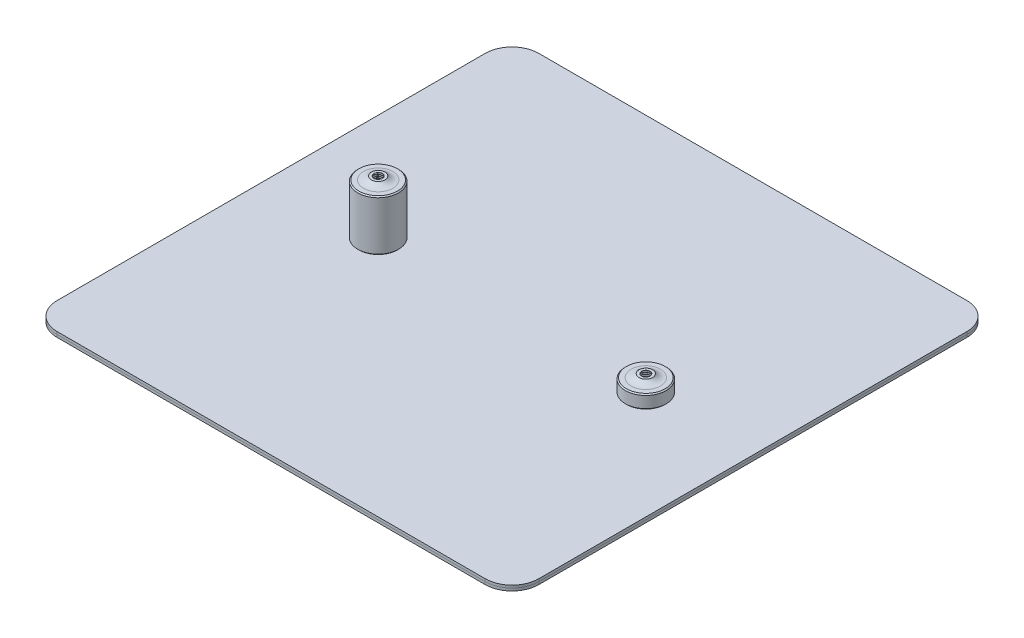
from build123d import *

# Parameters (mm, degrees)
CROQUIS1_R              = 4.9022
SALIENTE_EXTRUIR1_DEPTH = 2.4
CROQUIS2_R              = 19.05
CROQUIS2_R_2            = 3.96875
SALIENTE_EXTRUIR2_DEPTH = 47.625
CROQUIS3_R              = 6.35
CROQUIS3_R_2            = 3.96875
SALIENTE_EXTRUIR3_DEPTH = 3.175
REDONDEO1_R             = 10
ROSCA1_PITCH            = 1.5875
CROQUIS6_R              = 19.05
CROQUIS6_R_2            = 3.96875
SALIENTE_EXTRUIR4_DEPTH = 12.7
CROQUIS7_R              = 6.35
CROQUIS7_R_2            = 3.96875
SALIENTE_EXTRUIR5_DEPTH = 3.175
REDONDEO2_R             = 10
ROSCA2_PITCH            = 1.5875
CHAFL_N1_SIZE           = 1
CHAFL_N2_SIZE           = 1


with BuildPart() as part:
    # Croquis1 → Saliente-Extruir1 (new body)
    with BuildSketch(Plane(origin=(0, 0, 0), x_dir=(1, 0, 0), z_dir=(0, 1, 0))):
        with BuildLine():
            Line((-200, 225), (200, 225))
            ThreePointArc((200, 225), (217.67766953, 217.67766953), (225, 200))
            Line((225, 200), (225, -200))
            ThreePointArc((225, -200), (217.67766953, -217.67766953), (200, -225))
            Line((200, -225), (-200, -225))
            ThreePointArc((-200, -225), (-217.67766953, -217.67766953), (-225, -200))
            Line((-225, -200), (-225, 200))
            ThreePointArc((-225, 200), (-217.67766953, 217.67766953), (-200, 225))
        make_face()
        with Locations(Location((-125, 0, 0), (0, 0, 270))):
            Circle(CROQUIS1_R, mode=Mode.SUBTRACT)
        with Locations(Location((125, 0, 0), (0, 0, 90))):
            Circle(CROQUIS1_R, mode=Mode.SUBTRACT)
    extrude(amount=SALIENTE_EXTRUIR1_DEPTH)


with BuildPart() as body_2:
    # Simetría1: mirrored copy
    add(part.part.mirror(Plane(origin=(-200, 2.4, 200), x_dir=(0, 0, 1), z_dir=(0, 1, 0))))


with BuildPart() as body_3:
    # Croquis2 → Saliente-Extruir2 (new body)
    with BuildSketch(Plane(origin=(0, 4.8, 0), x_dir=(1, 0, 0), z_dir=(0, 1, 0))):
        with Locations(Location((-125, 0, 0), (0, 0, 270))):
            Circle(CROQUIS2_R)
        with Locations(Location((-125, 0, 0), (0, 0, 270))):
            Circle(CROQUIS2_R_2, mode=Mode.SUBTRACT)
    extrude(amount=SALIENTE_EXTRUIR2_DEPTH)

    # Croquis3 → Saliente-Extruir3 (add)
    with BuildSketch(Plane(origin=(0, 52.425, 0), x_dir=(1, 0, 0), z_dir=(0, 1, 0))):
        with Locations(Location((-125, 0, 0), (0, 0, 270))):
            Circle(CROQUIS3_R)
        with Locations(Location((-125, 0, 0), (0, 0, 270))):
            Circle(CROQUIS3_R_2, mode=Mode.SUBTRACT)
    extrude(amount=SALIENTE_EXTRUIR3_DEPTH)

    # Redondeo1
    # the kernel refuses this fillet: 10 mm, written as the material it adds along each edge
    with BuildSketch(Plane(origin=(-125, 52.425, 0), x_dir=(0, 0, 1), z_dir=(-1, 0, 0))) as redondeo1_piece_1:
        with BuildLine():
            CenterArc((13.65885593, 10), REDONDEO1_R, 223.039312102, 46.960687898)
            Line((6.35, 3.175), (6.203822881, 3.0385))
            ThreePointArc((6.203822881, 3.0385), (6.15, 1.5875), (6.15, 0))
            Line((6.15, 0), (6.35, -0.2))
            Line((6.35, -0.2), (13.65885593, -0.2))
            Line((13.65885593, -0.2), (13.65885593, 0))
        make_face()
    revolve(axis=Axis((-125, 52.425, 0), (0, 1, 0)))

    # Rosca1: arcs per turn and ends read off the stored shape
    # Rosca1: the profile of Perfil de rosca1 profile screwed along a right-hand helix through 32 turns, 8 arcs to a turn; built about Z, then put on its axis
    rosca1_z = Axis((0, 0, 0), (0, 0, 1))
    rosca1_corners = [(3.96845, 0, -0.000173205), (4.828009577, 0, 0.496093748), (4.828009577, 0, 0.694531248), (3.96845, 0, 1.190798201)]
    with BuildLine(mode=Mode.PRIVATE) as rosca1_profile:
        Line(rosca1_corners[0], rosca1_corners[1])
        Line(rosca1_corners[1], rosca1_corners[2])
        Line(rosca1_corners[2], rosca1_corners[3])
        Line(rosca1_corners[3], rosca1_corners[0])
    rosca1_cap = Face(rosca1_profile.wire())
    rosca1_turn_angles = [0, 22.5, 45, 67.5, 90, 112.5, 135, 157.5, 180, 202.5, 225, 247.5, 270, 292.5, 315, 337.5, 360]
    rosca1_turn_weights = [1, 0.9238795325112867, 1, 0.9238795325112867, 1, 0.9238795325112867, 1, 0.9238795325112867, 1, 0.9238795325112867, 1, 0.9238795325112867, 1, 0.9238795325112867, 1, 0.9238795325112867, 1]
    rosca1_turn_rails = [Edge.make_bspline([Vector(p[0], p[1], 0).rotate(rosca1_z, rosca1_turn_angles[k]) / rosca1_turn_weights[k] + Vector(0, 0, p[2] + ROSCA1_PITCH * rosca1_turn_angles[k] / 360) for k in range(17)], [0, 0, 0, 1, 1, 2, 2, 3, 3, 4, 4, 5, 5, 6, 6, 7, 7, 8, 8, 8], 2, rosca1_turn_weights) for p in rosca1_corners]
    rosca1_turn_sides = [Face.make_surface_from_curves(rosca1_turn_rails[p[0]], rosca1_turn_rails[p[1]]) for p in [(0, 1), (1, 2), (2, 3), (3, 0)]]
    rosca1 = Plane(origin=(-125, 55.6, 0), x_dir=(-1, 0, 0), z_dir=(0, -1, 0)) * Solid(Shell([*[p.moved(Location((0, 0, ROSCA1_PITCH * i))) for i in range(32) for p in rosca1_turn_sides], rosca1_cap, rosca1_cap.rotate(rosca1_z, 11520).moved(Location((0, 0, ROSCA1_PITCH * 11520 / 360)))]))
    add(rosca1, mode=Mode.SUBTRACT)

    # Chaflán1
    chafl_n1_edges = [body_3.edges().sort_by_distance(p)[0] for p in [
        (-125, 4.8, -19.05),
        (-125, 52.425, -19.05),
    ]]
    chamfer(chafl_n1_edges, length=CHAFL_N1_SIZE)


with BuildPart() as body_4:
    # Croquis6 → Saliente-Extruir4 (new body)
    with BuildSketch(Plane(origin=(0, 4.8, 0), x_dir=(1, 0, 0), z_dir=(0, 1, 0))):
        with Locations(Location((125, 0, 0), (0, 0, 270))):
            Circle(CROQUIS6_R)
        with Locations(Location((125, 0, 0), (0, 0, 270))):
            Circle(CROQUIS6_R_2, mode=Mode.SUBTRACT)
    extrude(amount=SALIENTE_EXTRUIR4_DEPTH)

    # Croquis7 → Saliente-Extruir5 (add)
    with BuildSketch(Plane(origin=(0, 17.5, 0), x_dir=(1, 0, 0), z_dir=(0, 1, 0))):
        with Locations(Location((125, 0, 0), (0, 0, 270))):
            Circle(CROQUIS7_R)
        with Locations(Location((125, 0, 0), (0, 0, 270))):
            Circle(CROQUIS7_R_2, mode=Mode.SUBTRACT)
    extrude(amount=SALIENTE_EXTRUIR5_DEPTH)

    # Redondeo2
    # the kernel refuses this fillet: 10 mm, written as the material it adds along each edge
    with BuildSketch(Plane(origin=(125, 17.5, 0), x_dir=(0, 0, 1), z_dir=(-1, 0, 0))) as redondeo2_piece_1:
        with BuildLine():
            CenterArc((13.65885593, 10), REDONDEO2_R, 223.039312102, 46.960687898)
            Line((6.35, 3.175), (6.203822881, 3.0385))
            ThreePointArc((6.203822881, 3.0385), (6.15, 1.5875), (6.15, 0))
            Line((6.15, 0), (6.35, -0.2))
            Line((6.35, -0.2), (13.65885593, -0.2))
            Line((13.65885593, -0.2), (13.65885593, 0))
        make_face()
    revolve(axis=Axis((125, 17.5, 0), (0, 1, 0)))

    # Rosca2: arcs per turn and ends read off the stored shape
    # Rosca2: the profile of Perfil de rosca2 profile screwed along a right-hand helix through 10 turns, 8 arcs to a turn; built about Z, then put on its axis
    rosca2_z = Axis((0, 0, 0), (0, 0, 1))
    rosca2_corners = [(3.96845, 0, -0.000173205), (4.828009577, 0, 0.496093748), (4.828009577, 0, 0.694531248), (3.96845, 0, 1.190798201)]
    with BuildLine(mode=Mode.PRIVATE) as rosca2_profile:
        Line(rosca2_corners[0], rosca2_corners[1])
        Line(rosca2_corners[1], rosca2_corners[2])
        Line(rosca2_corners[2], rosca2_corners[3])
        Line(rosca2_corners[3], rosca2_corners[0])
    rosca2_cap = Face(rosca2_profile.wire())
    rosca2_turn_angles = [0, 22.5, 45, 67.5, 90, 112.5, 135, 157.5, 180, 202.5, 225, 247.5, 270, 292.5, 315, 337.5, 360]
    rosca2_turn_weights = [1, 0.9238795325112867, 1, 0.9238795325112867, 1, 0.9238795325112867, 1, 0.9238795325112867, 1, 0.9238795325112867, 1, 0.9238795325112867, 1, 0.9238795325112867, 1, 0.9238795325112867, 1]
    rosca2_turn_rails = [Edge.make_bspline([Vector(p[0], p[1], 0).rotate(rosca2_z, rosca2_turn_angles[k]) / rosca2_turn_weights[k] + Vector(0, 0, p[2] + ROSCA2_PITCH * rosca2_turn_angles[k] / 360) for k in range(17)], [0, 0, 0, 1, 1, 2, 2, 3, 3, 4, 4, 5, 5, 6, 6, 7, 7, 8, 8, 8], 2, rosca2_turn_weights) for p in rosca2_corners]
    rosca2_turn_sides = [Face.make_surface_from_curves(rosca2_turn_rails[p[0]], rosca2_turn_rails[p[1]]) for p in [(0, 1), (1, 2), (2, 3), (3, 0)]]
    rosca2 = Plane(origin=(125, 20.675, 0), x_dir=(-1, 0, 0), z_dir=(0, -1, 0)) * Solid(Shell([*[p.moved(Location((0, 0, ROSCA2_PITCH * i))) for i in range(10) for p in rosca2_turn_sides], rosca2_cap, rosca2_cap.rotate(rosca2_z, 3600).moved(Location((0, 0, ROSCA2_PITCH * 3600 / 360)))]))
    add(rosca2, mode=Mode.SUBTRACT)

    # Chaflán2
    chafl_n2_edges = [body_4.edges().sort_by_distance(p)[0] for p in [
        (125, 4.8, -19.05),
        (125, 17.5, -19.05),
    ]]
    chamfer(chafl_n2_edges, length=CHAFL_N2_SIZE)


solid = Compound([part.part, body_2.part, body_3.part, body_4.part])
